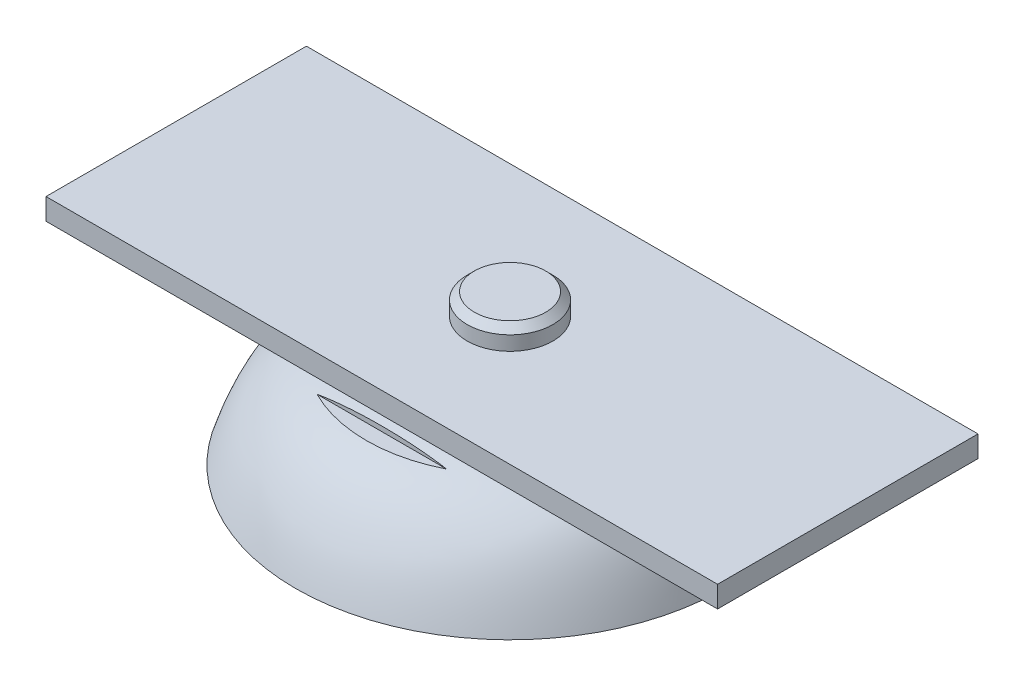
from build123d import *

# Parameters (mm, degrees)
BOSS_EXTRUDE1_DEPTH = 3
CUT_EXTRUDE1_DEPTH  = 58.221062556
SKETCH4_R           = 6
BOSS_EXTRUDE2_DEPTH = 3
CHAMFER1_SIZE       = 1
SKETCH5_W           = 111.338418069
SKETCH5_H           = 78.387795899
SKETCH5_W_2         = 94
SKETCH5_H_2         = 36.449417866
CUT_EXTRUDE2_DEPTH  = 5


with BuildPart() as part:
    # Sketch1 → Boss-Extrude1 (new body)
    with BuildSketch(Plane(origin=(0, 0, 0), x_dir=(1, 0, 0), z_dir=(0, 1, 0))):
        with BuildLine():
            Line((42, -32.5), (-42, -32.5))
            ThreePointArc((-42, -32.5), (-45.535533906, -31.035533906), (-47, -27.5))
            Line((-47, -27.5), (-47, 27.5))
            ThreePointArc((-47, 27.5), (-45.535533906, 31.035533906), (-42, 32.5))
            Line((-42, 32.5), (42, 32.5))
            ThreePointArc((42, 32.5), (45.535533906, 31.035533906), (47, 27.5))
            Line((47, 27.5), (47, -27.5))
            ThreePointArc((47, -27.5), (45.535533906, -31.035533906), (42, -32.5))
        make_face()
    extrude(amount=BOSS_EXTRUDE1_DEPTH)

    # Sketch2 → Cut-Extrude1 (cut, through all)
    with BuildSketch(Plane(origin=(0, 3, 0), x_dir=(1, 0, 0), z_dir=(0, 1, 0))):
        with BuildLine():
            Line((-39, 26.5), (-35, 26.5))
            ThreePointArc((-35, 26.5), (-31, 22.5), (-35, 18.5))
            Line((-35, 18.5), (-39, 18.5))
            ThreePointArc((-39, 18.5), (-43, 22.5), (-39, 26.5))
        make_face()
        with BuildLine():
            Line((39, 26.5), (35, 26.5))
            ThreePointArc((35, 26.5), (31, 22.5), (35, 18.5))
            Line((35, 18.5), (39, 18.5))
            ThreePointArc((39, 18.5), (43, 22.5), (39, 26.5))
        make_face()
        with BuildLine():
            Line((-39, -26.5), (-35, -26.5))
            ThreePointArc((-35, -26.5), (-31, -22.5), (-35, -18.5))
            Line((-35, -18.5), (-39, -18.5))
            ThreePointArc((-39, -18.5), (-43, -22.5), (-39, -26.5))
        make_face()
        with BuildLine():
            Line((39, -26.5), (35, -26.5))
            ThreePointArc((35, -26.5), (31, -22.5), (35, -18.5))
            Line((35, -18.5), (39, -18.5))
            ThreePointArc((39, -18.5), (43, -22.5), (39, -26.5))
        make_face()
    extrude(amount=-CUT_EXTRUDE1_DEPTH, mode=Mode.SUBTRACT)

    # Sketch4 → Boss-Extrude2 (add)
    with BuildSketch(Plane(origin=(0, 3, 0), x_dir=(1, 0, 0), z_dir=(0, 1, 0))):
        Circle(SKETCH4_R)
    extrude(amount=BOSS_EXTRUDE2_DEPTH)

    # Chamfer1
    chamfer1_edges = [part.edges().sort_by_distance(p)[0] for p in [
        (-6, 6, 0),
    ]]
    chamfer(chamfer1_edges, length=CHAMFER1_SIZE)


with BuildPart() as body_2:
    # Sketch3 → Revolve1 (revolve)
    with BuildSketch(Plane.XY):
        with BuildLine():
            Line((-30, -15), (-29.047609908, -15.304882128))
            add(Edge.make_bspline(
                [(0, -1), (-0.634970121, -1), (-1.927483787, -1.003111747), (-4.331871747, -1.02423995), (-7.131597475, -1.08317924), (-10.143047468, -1.22040905), (-13.73501387, -1.510478494), (-17.474492238, -2.107450956), (-20.924992245, -3.287407005), (-23.557460983, -5.00265737), (-25.312832043, -7.010318355), (-26.557667708, -9.072790185), (-27.427205946, -10.865239822), (-28.115311101, -12.583067826), (-28.648775741, -14.085031289), (-28.918813869, -14.902549357), (-29.047609908, -15.304882128)],
                knots=[0, 0, 0, 0, 0.03125, 0.0625, 0.125, 0.1875, 0.25, 0.375, 0.5, 0.625, 0.75, 0.8125, 0.875, 0.9375, 0.96875, 1, 1, 1, 1], degree=3))
            Line((0, -1), (0, 0))
            add(Edge.make_bspline(
                [(0, 0), (-20.874020428, 0), (-25.709367455, -1.596931879), (-30, -15)],
                knots=[0, 0, 0, 0, 1, 1, 1, 1], degree=3))
        make_face()
    revolve(axis=Axis((0, 0, 0), (0, -1, 0)))


with BuildPart() as cut_extrude2_tool:
    # Sketch5 → Cut-Extrude2 (new body)
    with BuildSketch(Plane(origin=(0, 3, 0), x_dir=(1, 0, 0), z_dir=(0, 1, 0))):
        with Locations((1.820955436, -0.26013649)):
            Rectangle(SKETCH5_W, SKETCH5_H)
        with Locations((0, 0.275291067)):
            Rectangle(SKETCH5_W_2, SKETCH5_H_2, mode=Mode.SUBTRACT)
    extrude(amount=-CUT_EXTRUDE2_DEPTH)


with BuildPart() as part_1:
    add(part.part)

    # Cut-Extrude2: cut by cut_extrude2_tool
    add(cut_extrude2_tool.part, mode=Mode.SUBTRACT)


with BuildPart() as body_2_1:
    add(body_2.part)

    # Cut-Extrude2: cut by cut_extrude2_tool
    add(cut_extrude2_tool.part, mode=Mode.SUBTRACT)


solid = Compound([part_1.part, body_2_1.part])
